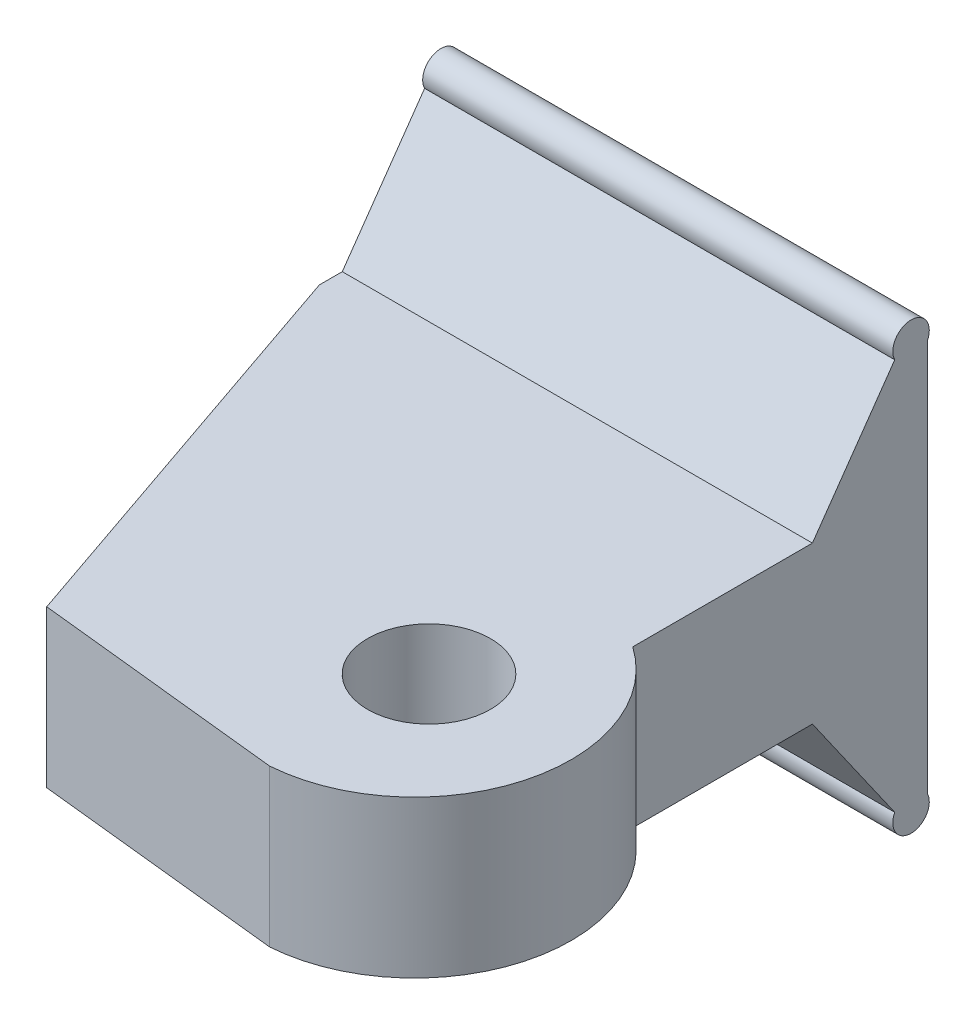
from build123d import *

# Parameters (mm, degrees)
SKETCH1_R               = 2.4892
BOSS_EXTRUDE1_DEPTH     = 6.35
BOSS_EXTRUDE2_START     = -6.35
BOSS_EXTRUDE2_DEPTH     = 19.05
BOSS_EXTRUDE2_START_2   = -6.555460136
BOSS_EXTRUDE2_2_DEPTH   = 19.460920272
BOSS_EXTRUDE2_START_3   = -10
BOSS_EXTRUDE2_3_DEPTH   = 3.65
CUT_EXTRUDE1_DEPTH      = 27.910448217
CUT_EXTRUDE1_DEPTH_BACK = 27.910448217
SKETCH3_W               = 2.179354936
SKETCH3_H               = 6.35
CUT_EXTRUDE2_DEPTH      = 31.98795935
CUT_EXTRUDE2_DEPTH_BACK = 31.98795935


with BuildPart() as part:
    # Sketch1 → Boss-Extrude1 (new body)
    with BuildSketch(Plane(origin=(0, 0, 0), x_dir=(1, 0, 0), z_dir=(0, 1, 0))):
        with BuildLine():
            Line((9.525, -17.889269346), (-0.578271622, -16.817120786))
            Line((-0.578271622, -16.817120786), (-6.35, 0))
            Line((-6.35, 0), (12.7, 0))
            Line((12.7, 0), (12.7, -6.35))
            ThreePointArc((12.7, -6.35), (15.186560179, -13.240601753), (9.525, -17.889269346))
        make_face()
        with Locations(Location((9.525, -11.43, 0), (0, 0, 270))):
            Circle(SKETCH1_R, mode=Mode.SUBTRACT)
    extrude(amount=BOSS_EXTRUDE1_DEPTH)

    # Boss-Extrude2: read off the stored shape, not the designer's step
    # Boss-Extrude2 outline → Boss-Extrude2 (add)
    with BuildSketch(Plane.YZ.offset(BOSS_EXTRUDE2_START)):
        with BuildLine():
            ThreePointArc((11.551615481, -6.35), (12.905510296, -4.996105185), (11.551615481, -3.642210371))
            Line((11.551615481, -3.642210371), (6.35, 0))
            Line((6.35, 0), (0, 0))
            Line((0, 0), (-5.201615481, -3.642210371))
            ThreePointArc((-5.201615481, -3.642210371), (-6.555510296, -4.996105185), (-5.201615481, -6.35))
            Line((-5.201615481, -6.35), (11.551615481, -6.35))
        make_face()
    extrude(amount=BOSS_EXTRUDE2_DEPTH)

    # Boss-Extrude2 2 outline → Boss-Extrude2 2 (add)
    with BuildSketch(Plane(origin=(0, 0, 0), x_dir=(1, 0, 0), z_dir=(0, 1, 0)).offset(BOSS_EXTRUDE2_START_2)):
        Polygon((-8.529354936, 6.35), (-6.35, 0), (-6.35, 6.35), align=None)
    extrude(amount=BOSS_EXTRUDE2_2_DEPTH)

    # Boss-Extrude2 3 outline → Boss-Extrude2 3 (cut)
    with BuildSketch(Plane.YZ.offset(BOSS_EXTRUDE2_START_3)):
        with BuildLine():
            Line((12.905460136, 0), (6.35, 0))
            Line((6.35, 0), (11.551615481, -3.642210371))
            ThreePointArc((11.551615481, -3.642210371), (12.504834401, -4.034645431), (12.905460136, -4.984450993))
            Line((12.905460136, -4.984450993), (12.905460136, 0))
        make_face()
        with BuildLine():
            ThreePointArc((12.905460136, -5.007759378), (12.504834401, -5.95756494), (11.551615481, -6.35))
            Line((11.551615481, -6.35), (12.905460136, -6.35))
            Line((12.905460136, -6.35), (12.905460136, -5.007759378))
        make_face()
        with BuildLine():
            Line((0, 0), (-6.555460136, 0))
            Line((-6.555460136, 0), (-6.555460136, -4.984450993))
            ThreePointArc((-6.555460136, -4.984450993), (-6.154834401, -4.034645431), (-5.201615481, -3.642210371))
            Line((-5.201615481, -3.642210371), (0, 0))
        make_face()
        with BuildLine():
            ThreePointArc((-5.201615481, -6.35), (-6.154834401, -5.95756494), (-6.555460136, -5.007759378))
            Line((-6.555460136, -5.007759378), (-6.555460136, -6.35))
            Line((-6.555460136, -6.35), (-5.201615481, -6.35))
        make_face()
    extrude(amount=BOSS_EXTRUDE2_3_DEPTH, mode=Mode.SUBTRACT)

    # Sketch3 → Cut-Extrude1 (cut, two sides: drawn at the far end of the back side and taken through both)
    with BuildSketch(Plane.XZ.offset(-CUT_EXTRUDE1_DEPTH_BACK)):
        with Locations((-7.439677468, -3.175)):
            Rectangle(SKETCH3_W, SKETCH3_H)
    extrude(amount=CUT_EXTRUDE1_DEPTH + CUT_EXTRUDE1_DEPTH_BACK, mode=Mode.SUBTRACT)

    # Sketch4 → Cut-Extrude2 (cut, two sides: drawn at the far end of the back side and taken through both)
    with BuildSketch(Plane.ZY.offset(6.35).offset(-CUT_EXTRUDE2_DEPTH_BACK)):
        with BuildLine():
            ThreePointArc((-5.588, -4.764550237), (-4.927202114, -5.833718802), (-4.266404229, -4.764550237))
            Line((-4.266404229, -4.764550237), (-0.930230237, 0))
            Line((-0.930230237, 0), (0, 0))
            Line((0, 0), (-3.642210371, -5.201615481))
            ThreePointArc((-3.642210371, -5.201615481), (-4.996105185, -6.555510296), (-6.35, -5.201615481))
            Line((-6.35, -5.201615481), (-6.35, 11.551615481))
            ThreePointArc((-6.35, 11.551615481), (-4.996105185, 12.905510296), (-3.642210371, 11.551615481))
            Line((-3.642210371, 11.551615481), (0, 6.35))
            Line((0, 6.35), (-0.930230237, 6.35))
            Line((-0.930230237, 6.35), (-4.266404229, 11.114550237))
            ThreePointArc((-4.266404229, 11.114550237), (-4.927202114, 12.183718802), (-5.588, 11.114550237))
            Line((-5.588, 11.114550237), (-5.588, -4.764550237))
        make_face()
    extrude(amount=CUT_EXTRUDE2_DEPTH + CUT_EXTRUDE2_DEPTH_BACK, mode=Mode.SUBTRACT)


solid = part.part
